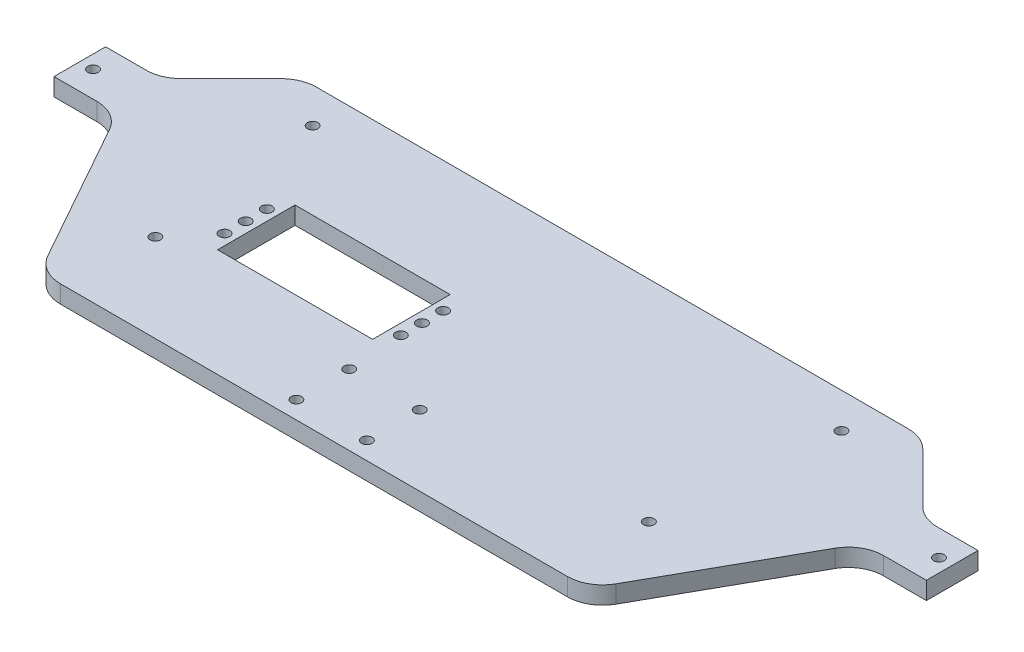
from build123d import *

# Parameters (mm, degrees)
SALIENTE_EXTRUIR1_DEPTH = 5
REDONDEO1_R             = 10
CROQUIS2_R              = 1.5
CROQUIS2_W              = 42
CROQUIS2_H              = 20
CORTAR_EXTRUIR1_DEPTH   = 135.669558943
CROQUIS3_W              = 4
CROQUIS3_H              = 14.636342218
CORTAR_EXTRUIR2_DEPTH   = 135.669558943
CROQUIS4_W              = 44
CROQUIS4_H              = 22
CORTAR_EXTRUIR3_DEPTH   = 131.881206084


with BuildPart() as part:
    # Croquis1 → Saliente-Extruir1 (new body)
    with BuildSketch(Plane(origin=(0, 0, 0), x_dir=(1, 0, 0), z_dir=(0, 1, 0))):
        Polygon((-88.1, 42.318171109), (88.1, 42.318171109), (108.1, 22.318171109), (127.75, 22.318171109), (127.75, 7.681828891), (105.75, 7.681828891), (77.75, -42.318171109), (-77.75, -42.318171109), (-105.75, 7.681828891), (-127.75, 7.681828891), (-127.75, 22.318171109), (-108.1, 22.318171109), align=None)
    extrude(amount=SALIENTE_EXTRUIR1_DEPTH)

    # Redondeo1
    redondeo1_edges = [part.edges().sort_by_distance(p)[0] for p in [
        (88.1, 2.5, -42.318171109),
        (-88.1, 2.5, -42.318171109),
        (-77.75, 2.5, 42.318171109),
        (77.75, 2.5, 42.318171109),
        (108.1, 2.5, -22.318171109),
        (105.75, 2.5, -7.681828891),
        (-105.75, 2.5, -7.681828891),
        (-108.1, 2.5, -22.318171109),
    ]]
    fillet(redondeo1_edges, radius=REDONDEO1_R)

    # Croquis2 → Cortar-Extruir1 (cut, through all)
    with BuildSketch(Plane(origin=(0, 5, 0), x_dir=(1, 0, 0), z_dir=(0, 1, 0))):
        with Locations((70, -17.318171109)):
            Circle(CROQUIS2_R)
        with Locations((-70, -17.318171109)):
            Circle(CROQUIS2_R)
        with Locations((-119.996067812, 15)):
            Circle(CROQUIS2_R)
        with Locations((119.996067812, 15)):
            Circle(CROQUIS2_R)
        with Locations((-75, 32.318171109)):
            Circle(CROQUIS2_R)
        with Locations((75, 32.318171109)):
            Circle(CROQUIS2_R)
        with Locations((-10, -22.318171109)):
            Circle(CROQUIS2_R)
        with Locations((10, -22.318171109)):
            Circle(CROQUIS2_R)
        with Locations((-10, -37.318171109)):
            Circle(CROQUIS2_R)
        with Locations((10, -37.318171109)):
            Circle(CROQUIS2_R)
        with Locations((-61, -0.681828891)):
            Circle(CROQUIS2_R)
        with Locations((-11, -0.681828891)):
            Circle(CROQUIS2_R)
        with Locations((-61, 5.318171109)):
            Circle(CROQUIS2_R)
        with Locations((-61, -6.681828891)):
            Circle(CROQUIS2_R)
        with Locations((-11, 5.318171109)):
            Circle(CROQUIS2_R)
        with Locations((-11, -6.681828891)):
            Circle(CROQUIS2_R)
        with Locations((-36, -0.681828891)):
            Rectangle(CROQUIS2_W, CROQUIS2_H)
    extrude(amount=-CORTAR_EXTRUIR1_DEPTH, mode=Mode.SUBTRACT)

    # Croquis3 → Cortar-Extruir2 (cut, through all)
    with BuildSketch(Plane(origin=(0, 5, 0), x_dir=(1, 0, 0), z_dir=(0, 1, 0))):
        with Locations((-125.75, 15)):
            Rectangle(CROQUIS3_W, CROQUIS3_H)
        with Locations((125.75, 15)):
            Rectangle(CROQUIS3_W, CROQUIS3_H)
    extrude(amount=-CORTAR_EXTRUIR2_DEPTH, mode=Mode.SUBTRACT)

    # Croquis4 → Cortar-Extruir3 (cut, through all)
    with BuildSketch(Plane(origin=(0, 5, 0), x_dir=(1, 0, 0), z_dir=(0, 1, 0))):
        with Locations((-36, -0.681828891)):
            Rectangle(CROQUIS4_W, CROQUIS4_H)
    extrude(amount=-CORTAR_EXTRUIR3_DEPTH, mode=Mode.SUBTRACT)


solid = part.part
